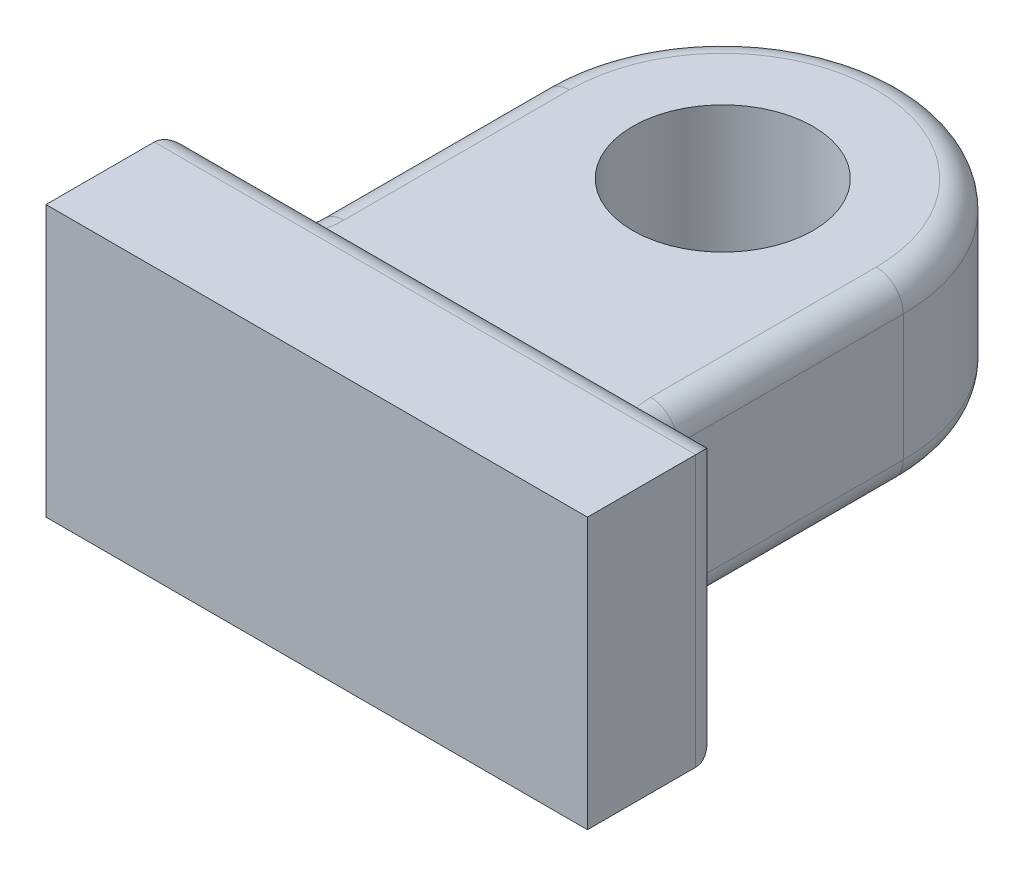
from build123d import *

# Parameters (mm, degrees)
SKETCH1_W           = 60
SKETCH1_H           = 30
BOSS_EXTRUDE1_DEPTH = 15
SKETCH2_R           = 10
BOSS_EXTRUDE2_DEPTH = 10
FILLET1_R           = 5
FILLET2_R           = 3


with BuildPart() as part:
    # Sketch1 → Boss-Extrude1 (new body)
    with BuildSketch(Plane.XY):
        Rectangle(SKETCH1_W, SKETCH1_H)
    extrude(amount=BOSS_EXTRUDE1_DEPTH)

    # Sketch2 → Boss-Extrude2 (add, symmetric)
    with BuildSketch(Plane(origin=(0, 0, 0), x_dir=(1, 0, 0), z_dir=(0, 1, 0))):
        with BuildLine():
            Line((-20, 30), (-20, 0))
            Line((-20, 0), (20, 0))
            Line((20, 0), (20, 30))
            ThreePointArc((20, 30), (0, 50), (-20, 30))
        make_face()
        with Locations(Location((0, 30, 0), (0, 0, 270))):
            Circle(SKETCH2_R, mode=Mode.SUBTRACT)
    extrude(amount=BOSS_EXTRUDE2_DEPTH, both=True)

    # Fillet1
    fillet1_edges = [part.edges().sort_by_distance(p)[0] for p in [
        (-20, 0, 0),
        (20, 0, 0),
    ]]
    fillet(fillet1_edges, radius=FILLET1_R)

    # Fillet2
    # the kernel refuses this fillet: 3 mm, written as the material it takes off along each edge
    with BuildSketch(Plane(origin=(0, 10, -30), x_dir=(1, 0, 0), z_dir=(0, 0, 1))) as fillet2_piece_1:
        with BuildLine():
            CenterArc((20 - FILLET2_R, -FILLET2_R), FILLET2_R, 0, 90)
            Line((20 - FILLET2_R, 0), (20, 0))
            Line((20, 0), (20, -FILLET2_R))
        make_face()
    revolve(axis=Axis((0, 10, -30), (0, 1, 0)), revolution_arc=180, mode=Mode.SUBTRACT)
    with BuildSketch(Plane(origin=(-20, 10, -30), x_dir=(0, -1, 0), z_dir=(0, 0, 1)), Plane(origin=(20, 10, -5), x_dir=(0, -1, 0), z_dir=(0, 0, -1))) as fillet2_piece_2:
        with BuildLine():
            CenterArc((FILLET2_R, FILLET2_R), FILLET2_R, 180, 90)
            Line((0, FILLET2_R), (0, 0))
            Line((0, 0), (FILLET2_R, 0))
        make_face()
    extrude(amount=25, mode=Mode.SUBTRACT)
    with BuildSketch(Plane(origin=(0, -10, -30), x_dir=(1, 0, 0), z_dir=(0, 0, 1))) as fillet2_piece_3:
        with BuildLine():
            CenterArc((20 - FILLET2_R, FILLET2_R), FILLET2_R, 270, 90)
            Line((20 - FILLET2_R, 0), (20, 0))
            Line((20, 0), (20, FILLET2_R))
        make_face()
    revolve(axis=Axis((0, -10, -30), (0, 1, 0)), revolution_arc=180, mode=Mode.SUBTRACT)
    with BuildSketch(Plane(origin=(-20, -10, -30), x_dir=(0, 1, 0), z_dir=(0, 0, 1)), Plane(origin=(20, -10, -5), x_dir=(0, 1, 0), z_dir=(0, 0, -1))) as fillet2_piece_4:
        with BuildLine():
            CenterArc((FILLET2_R, -FILLET2_R), FILLET2_R, 90, 90)
            Line((0, -FILLET2_R), (0, 0))
            Line((0, 0), (FILLET2_R, 0))
        make_face()
    extrude(amount=25, mode=Mode.SUBTRACT)
    with BuildSketch(Plane(origin=(25, -10, -5), x_dir=(0.9975374290817743, 0, 0.07013613605641604), z_dir=(0.07013613605641604, 0, -0.9975374290817743))) as fillet2_piece_5_section:
        with BuildLine():
            CenterArc((5 + FILLET2_R, -FILLET2_R), FILLET2_R, 90, 90)
            Line((5 + FILLET2_R, 0), (5, 0))
            Line((5, 0), (5, -FILLET2_R))
        make_face()
    fillet2_piece_5 = revolve(axis=Axis((25, -10, -5), (0, -1, 0)), revolution_arc=175.978193542, mode=Mode.PRIVATE)
    fillet2_piece_5 = split(fillet2_piece_5, bisect_by=Plane(origin=(21.314130097, -9.156886231, 0), z_dir=(0, 0, -1)), keep=Keep.TOP, mode=Mode.PRIVATE)
    add(fillet2_piece_5, mode=Mode.SUBTRACT)
    with BuildSketch(Plane(origin=(25, 10, -5), x_dir=(0.9975374290817743, 0, 0.07013613605641604), z_dir=(0.07013613605641604, 0, -0.9975374290817743))) as fillet2_piece_6_section:
        with BuildLine():
            CenterArc((5 + FILLET2_R, FILLET2_R), FILLET2_R, 180, 90)
            Line((5, FILLET2_R), (5, 0))
            Line((5, 0), (5 + FILLET2_R, 0))
        make_face()
    fillet2_piece_6 = revolve(axis=Axis((25, 10, -5), (0, -1, 0)), revolution_arc=175.978193542, mode=Mode.PRIVATE)
    fillet2_piece_6 = split(fillet2_piece_6, bisect_by=Plane(origin=(21.314129988, 9.156886191, 0), z_dir=(0, 0, -1)), keep=Keep.TOP, mode=Mode.PRIVATE)
    add(fillet2_piece_6, mode=Mode.SUBTRACT)
    with BuildSketch(Plane(origin=(-25, -10, -5), x_dir=(-0.9975374290817743, 0, 0.07013613605641587), z_dir=(-0.07013613605641587, 0, -0.9975374290817743))) as fillet2_piece_7_section:
        with BuildLine():
            CenterArc((5 + FILLET2_R, FILLET2_R), FILLET2_R, 180, 90)
            Line((5 + FILLET2_R, 0), (5, 0))
            Line((5, 0), (5, FILLET2_R))
        make_face()
    fillet2_piece_7 = revolve(axis=Axis((-25, -10, -5), (0, 1, 0)), revolution_arc=175.978193542, mode=Mode.PRIVATE)
    fillet2_piece_7 = split(fillet2_piece_7, bisect_by=Plane(origin=(-21.314129744, -9.156885957, 0), z_dir=(0, 0, -1)), keep=Keep.TOP, mode=Mode.PRIVATE)
    add(fillet2_piece_7, mode=Mode.SUBTRACT)
    with BuildSketch(Plane(origin=(-25, 10, -5), x_dir=(-0.9975374290817743, 0, 0.07013613605641587), z_dir=(-0.07013613605641587, 0, -0.9975374290817743))) as fillet2_piece_8_section:
        with BuildLine():
            CenterArc((5 + FILLET2_R, -FILLET2_R), FILLET2_R, 90, 90)
            Line((5 + FILLET2_R, 0), (5, 0))
            Line((5, 0), (5, -FILLET2_R))
        make_face()
    fillet2_piece_8 = revolve(axis=Axis((-25, 10, -5), (0, 1, 0)), revolution_arc=175.978193542, mode=Mode.PRIVATE)
    fillet2_piece_8 = split(fillet2_piece_8, bisect_by=Plane(origin=(-21.314129744, 9.156885957, 0), z_dir=(0, 0, -1)), keep=Keep.TOP, mode=Mode.PRIVATE)
    add(fillet2_piece_8, mode=Mode.SUBTRACT)
    with BuildSketch(Plane(origin=(37.5, -15, 0), x_dir=(0, 1, 0), z_dir=(-1, 0, 0)), Plane(origin=(-37.5, 15, 0), x_dir=(0, -1, 0), z_dir=(1, 0, 0))) as fillet2_piece_9:
        with BuildLine():
            CenterArc((FILLET2_R, -FILLET2_R), FILLET2_R, 90, 90)
            Line((0, -FILLET2_R), (0, 0))
            Line((0, 0), (FILLET2_R, 0))
        make_face()
    extrude(amount=75, mode=Mode.SUBTRACT)
    with BuildSketch(Plane(origin=(-30, -22.5, 0), x_dir=(1, 0, 0), z_dir=(0, 1, 0)), Plane(origin=(30, 22.5, 0), x_dir=(-1, 0, 0), z_dir=(0, -1, 0))) as fillet2_piece_10:
        with BuildLine():
            CenterArc((FILLET2_R, -FILLET2_R), FILLET2_R, 90, 90)
            Line((0, -FILLET2_R), (0, 0))
            Line((0, 0), (FILLET2_R, 0))
        make_face()
    extrude(amount=45, mode=Mode.SUBTRACT)


solid = part.part
